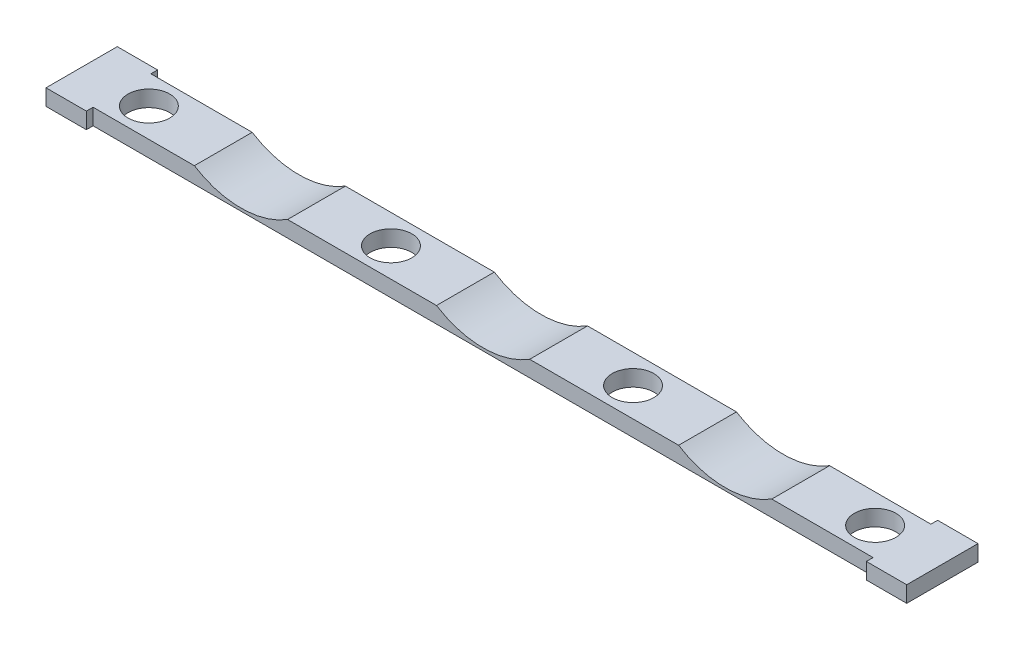
from build123d import *

# Parameters (mm, degrees)
BOSS_EXTRUDE1_DEPTH = 4.3
SKETCH2_R           = 1.55
CUT_EXTRUDE1_DEPTH  = 33.309905602
SKETCH3_W           = 3
SKETCH3_H           = 1.2
BOSS_EXTRUDE2_DEPTH = 0.5


with BuildPart() as part:
    # Sketch1 → Boss-Extrude1 (new body)
    with BuildSketch(Plane.XY):
        with BuildLine():
            Line((-14.538653043, -11.5), (-3.464101615, -11.5))
            ThreePointArc((-3.464101615, -11.5), (0, -12.5), (3.464101615, -11.5))
            Line((3.464101615, -11.5), (14.538653043, -11.5))
            ThreePointArc((14.538653043, -11.5), (18.002754658, -12.5), (21.466856273, -11.5))
            Line((21.466856273, -11.5), (32, -11.5))
            Line((32, -11.5), (32, -12.7))
            Line((32, -12.7), (-32, -12.7))
            Line((-32, -12.7), (-32, -11.5))
            Line((-32, -11.5), (-21.466856273, -11.5))
            ThreePointArc((-21.466856273, -11.5), (-18.002754658, -12.5), (-14.538653043, -11.5))
        make_face()
    extrude(amount=BOSS_EXTRUDE1_DEPTH)

    # Sketch2 → Cut-Extrude1 (cut, through all)
    with BuildSketch(Plane(origin=(0, -11.5, 0), x_dir=(1, 0, 0), z_dir=(0, 1, 0))):
        with Locations((-9, -2.15)):
            Circle(SKETCH2_R)
        with Locations((9, -2.15)):
            Circle(SKETCH2_R)
        with Locations((-27, -2.15)):
            Circle(SKETCH2_R)
        with Locations((27, -2.15)):
            Circle(SKETCH2_R)
    extrude(amount=-CUT_EXTRUDE1_DEPTH, mode=Mode.SUBTRACT)

    # Sketch3 → Boss-Extrude2 (add)
    with BuildSketch(Plane(origin=(0, 0, 0), x_dir=(-1, 0, 0), z_dir=(0, 0, -1))):
        with Locations((-30.5, -12.1)):
            Rectangle(SKETCH3_W, SKETCH3_H)
        with Locations((30.5, -12.1)):
            Rectangle(SKETCH3_W, SKETCH3_H)
    boss_extrude2 = extrude(amount=BOSS_EXTRUDE2_DEPTH)

    # Mirror1: Boss-Extrude2 across plane
    add(boss_extrude2.mirror(Plane(origin=(0, 0, 2.15), x_dir=(1, 0, 0), z_dir=(0, 0, -1))))


solid = part.part
